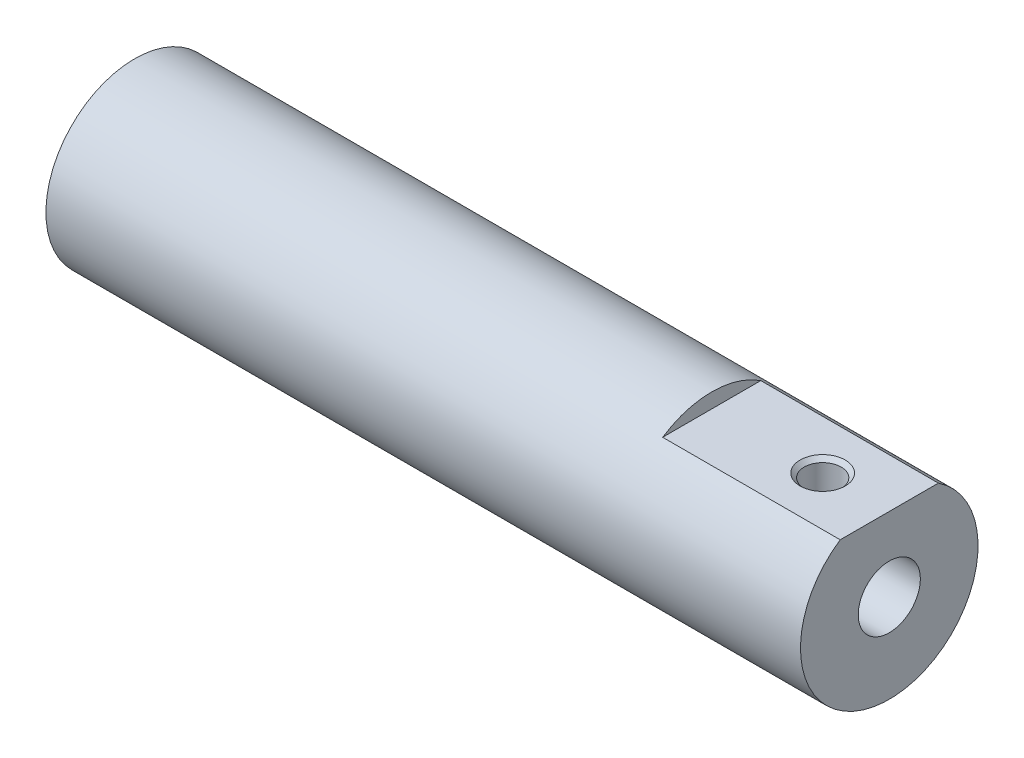
from build123d import *

# Parameters (mm, degrees)
SKETCH1_R                   = 6
BOSS_EXTRUDE1_DEPTH         = 51
CUT_EXTRUDE1_START          = -12
SKETCH2_R                   = 2.1
CUT_EXTRUDE1_DEPTH          = 12
M3_TAPPED_HOLE1_D           = 2.5
M3_TAPPED_HOLE1_DEPTH       = 6
M3_TAPPED_HOLE1_CSINK_D     = 3.05
M3_TAPPED_HOLE1_CSINK_ANGLE = 90
M3_TAPPED_HOLE1_TIP         = 0.751075774


with BuildPart() as part:
    # Sketch1 → Boss-Extrude1 (new body)
    with BuildSketch(Plane(origin=(0, 0, 0), x_dir=(0, 0, -1), z_dir=(1, 0, 0))):
        Circle(SKETCH1_R)
    extrude(amount=BOSS_EXTRUDE1_DEPTH)

    # Sketch2 → Cut-Extrude1 (cut)
    with BuildSketch(Plane(origin=(51, 0, 0), x_dir=(0, 0, -1), z_dir=(1, 0, 0)).offset(CUT_EXTRUDE1_START)):
        Circle(SKETCH2_R)
        with BuildLine():
            Line((-3.31662479, 5), (3.31662479, 5))
            ThreePointArc((3.31662479, 5), (0, 6), (-3.31662479, 5))
        make_face()
    extrude(amount=CUT_EXTRUDE1_DEPTH, mode=Mode.SUBTRACT)

    # M3 Tapped Hole1
    with Locations(Plane(origin=(46.5, 5, 0), x_dir=(0, 0, 1), z_dir=(0, 1, 0))):
        with Locations((0, 0)):
            CounterSinkHole(M3_TAPPED_HOLE1_D / 2, M3_TAPPED_HOLE1_CSINK_D / 2, depth=M3_TAPPED_HOLE1_DEPTH, counter_sink_angle=M3_TAPPED_HOLE1_CSINK_ANGLE)
            with Locations((0, 0, -(M3_TAPPED_HOLE1_DEPTH + M3_TAPPED_HOLE1_TIP / 2))):  # 118° drill point
                Cone(0, M3_TAPPED_HOLE1_D / 2, M3_TAPPED_HOLE1_TIP, mode=Mode.SUBTRACT)


solid = part.part
